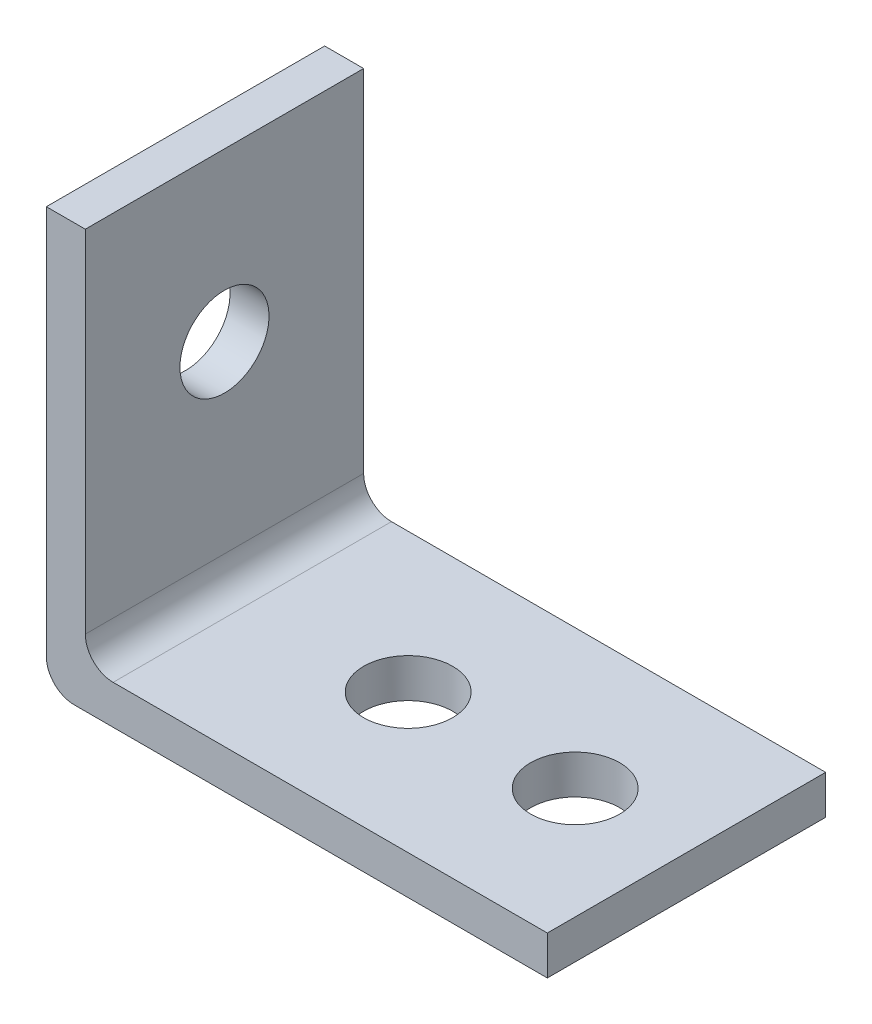
from build123d import *

# Parameters (mm, degrees)
BOSS_EXTRUDE1_DEPTH = 6.35
CUT_EXTRUDE1_REACH  = 32.427
SKETCH2_R           = 2.032
CUT_EXTRUDE2_REACH  = 32.427
SKETCH3_R           = 2.032
FILLET2_R           = 1.27
FILLET3_R           = 1.27
LPATTERN1_COUNT     = 2
LPATTERN1_PITCH     = 7.62


with BuildPart() as part:
    # Sketch1 → Boss-Extrude1 (new, symmetric)
    with BuildSketch(Plane.XY):
        Polygon((0, 0), (0, 19.05), (1.778, 19.05), (1.778, 1.778), (22.86, 1.778), (22.86, 0), align=None)
    extrude(amount=BOSS_EXTRUDE1_DEPTH, both=True)

    # Sketch2 → Cut-Extrude1 (cut, up to next)
    with BuildSketch(Plane.ZY, mode=Mode.PRIVATE) as cut_extrude1_sk1:
        with Locations((0, 11.43)):
            Circle(SKETCH2_R)
    cut_extrude1_tool1 = extrude(cut_extrude1_sk1.sketch, amount=-CUT_EXTRUDE1_REACH, mode=Mode.PRIVATE) & part.part
    add(cut_extrude1_tool1.solids().sort_by_distance((0, 11.43, 0))[0], mode=Mode.SUBTRACT)

    # Sketch3 → Cut-Extrude2 (cut, up to next)
    with BuildSketch(Plane.XZ, mode=Mode.PRIVATE) as cut_extrude2_sk1:
        with Locations((10.16, 0)):
            Circle(SKETCH3_R)
    cut_extrude2_tool1 = extrude(cut_extrude2_sk1.sketch, amount=-CUT_EXTRUDE2_REACH, mode=Mode.PRIVATE) & part.part
    cut_extrude2 = cut_extrude2_tool1.solids().sort_by_distance((10.16, 0, 0))[0]
    add(cut_extrude2, mode=Mode.SUBTRACT)

    # Fillet2
    fillet2_edges = [part.edges().sort_by_distance(p)[0] for p in [
        (1.778, 1.778, 0),
    ]]
    fillet(fillet2_edges, radius=FILLET2_R)

    # Fillet3
    fillet3_edges = [part.edges().sort_by_distance(p)[0] for p in [
        (0, 0, 0),
    ]]
    fillet(fillet3_edges, radius=FILLET3_R)

    # LPattern1: Cut-Extrude2 ×2
    with Locations(*[(i * LPATTERN1_PITCH, 0, 0) for i in range(1, LPATTERN1_COUNT)]):
        add(cut_extrude2, mode=Mode.SUBTRACT)


solid = part.part
